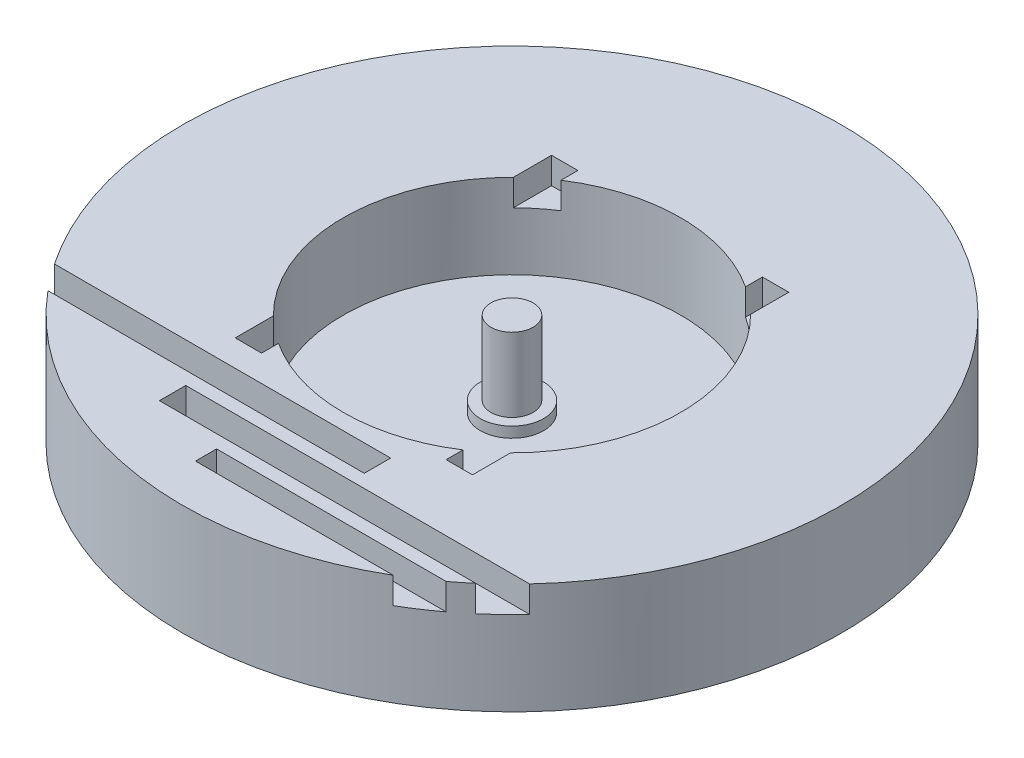
from build123d import *

# Parameters (mm, degrees)
SKETCH1_R           = 62.5
BOSS_EXTRUDE1_DEPTH = 21
SKETCH2_R           = 32
SKETCH2_R_2         = 6
CUT_EXTRUDE1_DEPTH  = 16
SKETCH3_R           = 6
SKETCH3_R_2         = 4
CUT_EXTRUDE2_DEPTH  = 14
SKETCH10_W          = 5
SKETCH10_H          = 60
CUT_EXTRUDE7_DEPTH  = 5
CUT_EXTRUDE8_START  = -5
CUT_EXTRUDE8_DEPTH  = 5


with BuildPart() as part:
    # Sketch1 → Boss-Extrude1 (new body)
    with BuildSketch(Plane(origin=(0, 0, 0), x_dir=(1, 0, 0), z_dir=(0, 1, 0))):
        Circle(SKETCH1_R)
    extrude(amount=BOSS_EXTRUDE1_DEPTH)

    # Sketch2 → Cut-Extrude1 (cut)
    with BuildSketch(Plane(origin=(0, 21, 0), x_dir=(1, 0, 0), z_dir=(0, 1, 0))):
        Circle(SKETCH2_R)
        Circle(SKETCH2_R_2, mode=Mode.SUBTRACT)
    extrude(amount=-CUT_EXTRUDE1_DEPTH, mode=Mode.SUBTRACT)

    # Sketch3 → Cut-Extrude2 (cut)
    with BuildSketch(Plane(origin=(0, 21, 0), x_dir=(1, 0, 0), z_dir=(0, 1, 0))):
        Circle(SKETCH3_R)
        Circle(SKETCH3_R_2, mode=Mode.SUBTRACT)
    extrude(amount=-CUT_EXTRUDE2_DEPTH, mode=Mode.SUBTRACT)

    # Sketch10 → Cut-Extrude7 (cut)
    with BuildSketch(Plane(origin=(0, 21, 0), x_dir=(1, 0, 0), z_dir=(0, 1, 0))):
        with Locations((-20, 0)):
            Rectangle(SKETCH10_W, SKETCH10_H)
        with Locations((20, 0)):
            Rectangle(SKETCH10_W, SKETCH10_H)
    extrude(amount=-CUT_EXTRUDE7_DEPTH, mode=Mode.SUBTRACT)

    # Sketch11 → Cut-Extrude8 (cut)
    with BuildSketch(Plane(origin=(0, 21, 0), x_dir=(1, 0, 0), z_dir=(0, 1, 0)).offset(CUT_EXTRUDE8_START)):
        with BuildLine():
            Line((11.976568219, -40), (-48.023431781, -40))
            ThreePointArc((-48.023431781, -40), (-49.964693221, -37.547029594), (-51.780787943, -35))
            Line((-51.780787943, -35), (11.976568219, -35))
            Line((11.976568219, -35), (11.976568219, -40))
        make_face()
        with BuildLine():
            Line((-19.379807977, -47.5), (40.620192023, -47.5))
            ThreePointArc((40.620192023, -47.5), (43.295213632, -45.075209113), (45.82575695, -42.5))
            Line((45.82575695, -42.5), (-19.379807977, -42.5))
            Line((-19.379807977, -42.5), (-19.379807977, -47.5))
        make_face()
        with BuildLine():
            Line((-6.031762045, -54), (31.468237955, -54))
            ThreePointArc((31.468237955, -54), (34.542067999, -52.087383677), (37.5, -50))
            Line((37.5, -50), (-6.031762045, -50))
            Line((-6.031762045, -50), (-6.031762045, -54))
        make_face()
    extrude(amount=CUT_EXTRUDE8_DEPTH, mode=Mode.SUBTRACT)


solid = part.part
